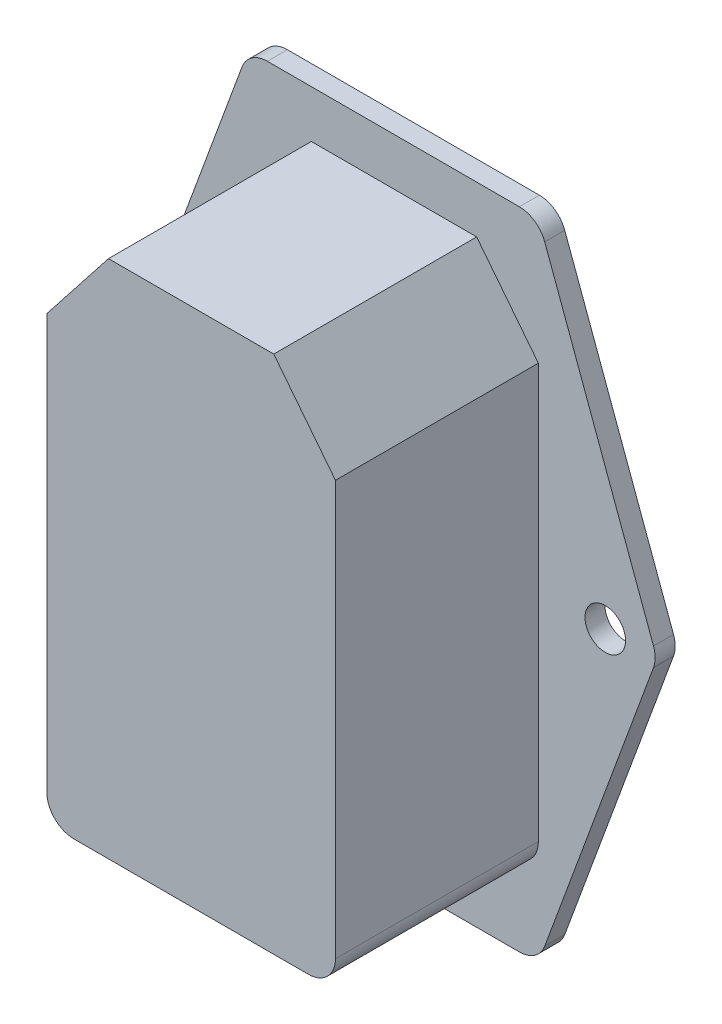
from build123d import *

# Parameters (mm, degrees)
BOSS_EXTRUDE1_DEPTH     = 19.05
BOSS_EXTRUDE2_DEPTH     = 1.8796
CUT_EXTRUDE1_DEPTH      = 22.606
CUT_EXTRUDE1_DEPTH_BACK = 20.4216
SKETCH6_R               = 1.905


with BuildPart() as part:
    # Sketch1 → Boss-Extrude1 (new body)
    with BuildSketch(Plane.XY):
        with BuildLine():
            Line((2.54, 0), (24.5618, 0))
            ThreePointArc((24.5618, 0), (26.357851224, 0.743948776), (27.1018, 2.54))
            Line((27.1018, 2.54), (27.1018, 41.4401))
            Line((27.1018, 41.4401), (21.3106, 48.809471297))
            Line((21.3106, 48.809471297), (5.7912, 48.809471297))
            Line((5.7912, 48.809471297), (0, 41.4401))
            Line((0, 41.4401), (0, 2.54))
            ThreePointArc((0, 2.54), (0.743948776, 0.743948776), (2.54, 0))
        make_face()
    extrude(amount=BOSS_EXTRUDE1_DEPTH)

    # Sketch2 → Boss-Extrude2 (add)
    with BuildSketch(Plane.XY):
        with BuildLine():
            Line((1.657581985, 53.267171297), (25.317218015, 53.267171297))
            ThreePointArc((25.317218015, 53.267171297), (26.770442849, 52.81037498), (27.700968665, 51.604287506))
            Line((27.700968665, 51.604287506), (37.914530402, 23.846751857))
            ThreePointArc((37.914530402, 23.846751857), (38.070779753, 22.969635649), (37.914530402, 22.09251944))
            Line((37.914530402, 22.09251944), (27.700968665, -5.665016208))
            ThreePointArc((27.700968665, -5.665016208), (26.770442849, -6.871103683), (25.317218015, -7.3279))
            Line((25.317218015, -7.3279), (1.657581985, -7.3279))
            ThreePointArc((1.657581985, -7.3279), (0.204357151, -6.871103683), (-0.726168665, -5.665016208))
            Line((-0.726168665, -5.665016208), (-10.939730402, 22.09251944))
            ThreePointArc((-10.939730402, 22.09251944), (-11.095979753, 22.969635649), (-10.939730402, 23.846751857))
            Line((-10.939730402, 23.846751857), (-0.726168665, 51.604287506))
            ThreePointArc((-0.726168665, 51.604287506), (0.204357151, 52.81037498), (1.657581985, 53.267171297))
        make_face()
    extrude(amount=-BOSS_EXTRUDE2_DEPTH)

    # Sketch6 → Cut-Extrude1 (cut, two sides: drawn at the far end of the back side and taken through both)
    with BuildSketch(Plane.XY.offset(-CUT_EXTRUDE1_DEPTH_BACK)):
        with Locations((33.384479753, 22.969635649)):
            Circle(SKETCH6_R)
        with Locations((-6.409679753, 22.969635649)):
            Circle(SKETCH6_R)
    extrude(amount=CUT_EXTRUDE1_DEPTH + CUT_EXTRUDE1_DEPTH_BACK, mode=Mode.SUBTRACT)


solid = part.part
